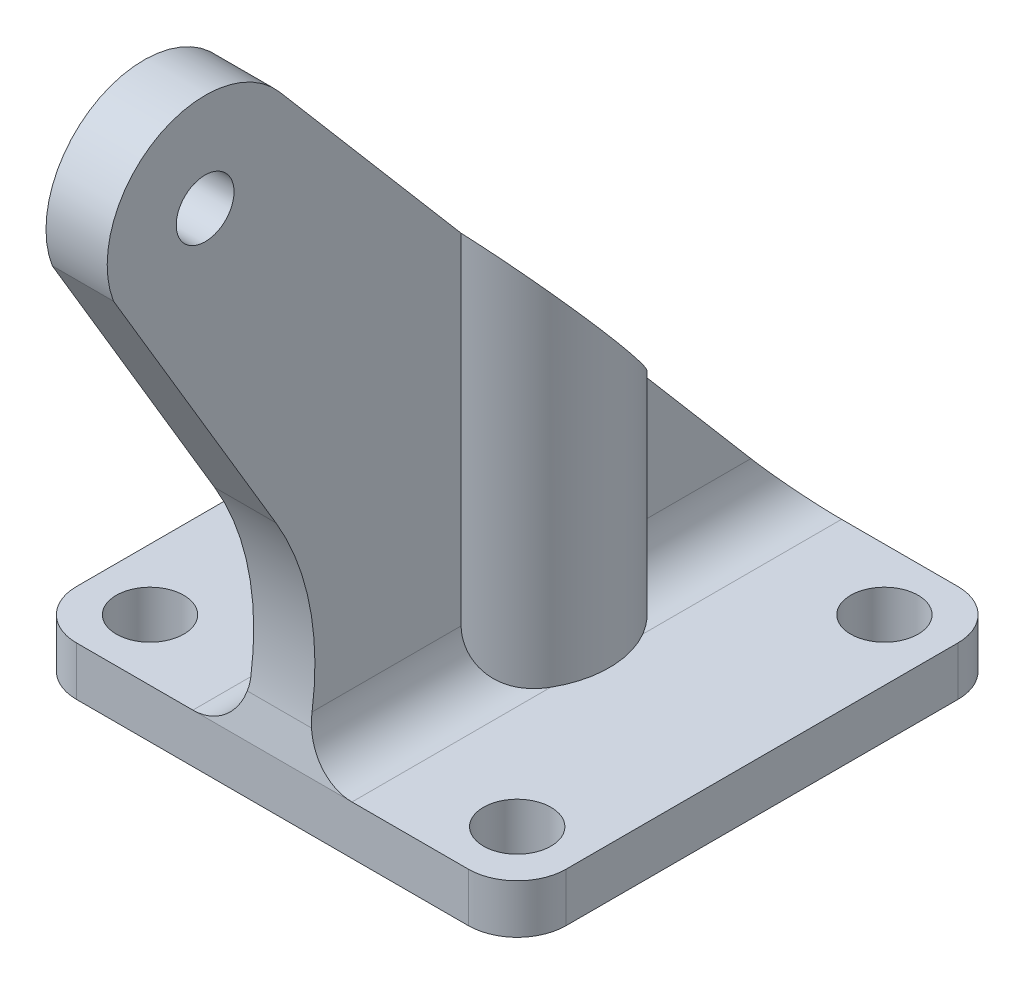
from build123d import *

# Parameters (mm, degrees)
BOSS_EXTRUDE1_DEPTH     = 2.54
SKETCH3_R               = 1.5000000000000009
BOSS_EXTRUDE2_DEPTH     = 1.5875
FILLET1_START           = -12.7000001
FILLET1_DEPTH           = 25.4000001
FILLET1_START_2         = -5
FILLET1_2_DEPTH         = 10
FILLET2_R               = 2.54
SKETCH4_R               = 3.5
BOSS_EXTRUDE3_DEPTH     = 7
SKETCH5_R               = 1.75
CUT_EXTRUDE1_DEPTH      = 45.14049388033623
CUT_EXTRUDE2_DEPTH      = 39.723935750385714
CUT_EXTRUDE2_DEPTH_BACK = 2
SKETCH6_R               = 3.5
SKETCH10_R              = 4.77
SKETCH10_R_2            = 3.5
BOSS_EXTRUDE4_DEPTH     = 21.844000000000005
SKETCH9_R               = 1.7499999999999998
CUT_EXTRUDE4_DEPTH      = 43.12113483751359
CUT_EXTRUDE5_DEPTH      = 45.62315381335121
CUT_EXTRUDE5_DEPTH_BACK = 45.62315381335121


with BuildPart() as part:
    # Sketch1 → Boss-Extrude1 (new body)
    with BuildSketch(Plane(origin=(0, 0, 0), x_dir=(1, 0, 0), z_dir=(0, 1, 0))):
        Polygon((-12.7, 12.699999999999998), (12.7, 12.699999999999998), (12.700000000000003, -12.700000000000001), (-12.699999999999996, -12.700000000000001), align=None)
    extrude(amount=BOSS_EXTRUDE1_DEPTH)

    # Sketch3 → Boss-Extrude2 (add, symmetric)
    with BuildSketch(Plane(origin=(0, 0, 0), x_dir=(0, 0, -1), z_dir=(1, 0, 0))):
        with BuildLine():
            Line((-22.53488, 28.691839999999996), (-14.109077453558108, 14.51812311143032))
            ThreePointArc((-14.109077453558108, 14.51812311143032), (-12.3014463794853, 9.646212675108597), (-12.336895325054973, 4.449888515498061))
            Line((-12.336895325054973, 4.449888515498061), (-12.700000000000001, 2.54))
            Line((-12.700000000000001, 2.54), (12.699999999999998, 2.54))
            Line((12.699999999999998, 2.54), (-13.91324894993197, 33.77463750916512))
            ThreePointArc((-13.91324894993197, 33.77463750916512), (-20.3599032710008, 34.856128324475804), (-22.53488, 28.691839999999996))
        make_face()
        with Locations((-17.779999999999998, 30.479999999999997)):
            Circle(SKETCH3_R, mode=Mode.SUBTRACT)
    extrude(amount=BOSS_EXTRUDE2_DEPTH, both=True)

    # Fillet1: read off the stored shape, not the designer's step
    # Fillet1 outline → Fillet1 (add)
    with BuildSketch(Plane.XY.offset(FILLET1_START)):
        with BuildLine():
            ThreePointArc((-1.5875, 5.08), (-2.331448776, 3.283948776), (-4.1275, 2.54))
            Line((-4.1275, 2.54), (-1.5875, 2.54))
            Line((-1.5875, 2.54), (-1.5875, 5.08))
        make_face()
        with BuildLine():
            Line((1.5875, 2.54), (4.1275, 2.54))
            ThreePointArc((4.1275, 2.54), (2.331448776, 3.283948776), (1.5875, 5.08))
            Line((1.5875, 5.08), (1.5875, 2.54))
        make_face()
    extrude(amount=FILLET1_DEPTH)

    # Fillet1 2 outline → Fillet1 2 (cut)
    with BuildSketch(Plane.YZ.offset(FILLET1_START_2)):
        Polygon((5.08, -10.535811211), (2.54, -12.7), (5.08, -12.7000001), align=None)
        with BuildLine():
            Line((5.08, 12.7), (2.54, 12.7))
            Line((2.54, 12.7), (4.449888515, 12.336895325))
            ThreePointArc((4.449888515, 12.336895325), (4.764360857, 12.280707955), (5.08, 12.231496116))
            Line((5.08, 12.231496116), (5.08, 12.7))
        make_face()
    extrude(amount=FILLET1_2_DEPTH, mode=Mode.SUBTRACT)

    # Fillet2
    fillet2_edges = [part.edges().sort_by_distance(p)[0] for p in [
        (12.7, 1.27, -12.699999999999998),
        (12.700000000000003, 1.27, 12.700000000000001),
        (-12.699999999999996, 1.27, 12.700000000000001),
        (-12.7, 1.27, -12.699999999999998),
    ]]
    fillet(fillet2_edges, radius=FILLET2_R)

    # Sketch4 → Boss-Extrude3 (add)
    with BuildSketch(Plane.XZ):
        Circle(SKETCH4_R)
    extrude(amount=-BOSS_EXTRUDE3_DEPTH)

    # Sketch5 → Cut-Extrude1 (cut, through all)
    with BuildSketch(Plane.XZ):
        with Locations(Location((0, 0, 0), (0, 0, 270))):
            Circle(SKETCH5_R)
    extrude(amount=-CUT_EXTRUDE1_DEPTH, mode=Mode.SUBTRACT)

    # Sketch6 → Cut-Extrude2 (cut, two sides: drawn at the far end of the back side and taken through both)
    with BuildSketch(Plane(origin=(0, 7, 0), x_dir=(1, 0, 0), z_dir=(0, 1, 0)).offset(-CUT_EXTRUDE2_DEPTH_BACK)):
        Circle(SKETCH6_R)
    extrude(amount=CUT_EXTRUDE2_DEPTH + CUT_EXTRUDE2_DEPTH_BACK, mode=Mode.SUBTRACT)

    # Sketch10 → Boss-Extrude4 (add)
    with BuildSketch(Plane(origin=(0, 2.54, 0), x_dir=(1, 0, 0), z_dir=(0, 1, 0))):
        with Locations(Location((0, 0, 0), (0, 0, 70.560627051))):
            Circle(SKETCH10_R)
        with Locations(Location((0, 0, 0), (0, 0, 270))):
            Circle(SKETCH10_R_2, mode=Mode.SUBTRACT)
    extrude(amount=BOSS_EXTRUDE4_DEPTH)

    # Sketch9 → Cut-Extrude4 (cut, through all)
    with BuildSketch(Plane(origin=(0, 2.54, 0), x_dir=(1, 0, 0), z_dir=(0, 1, 0))):
        with Locations(Location((-9.524999999999999, -9.525000000000002, 0), (0, 0, 270))):
            Circle(SKETCH9_R)
        with Locations(Location((-9.524999999999999, 9.524999999999999, 0), (0, 0, 270))):
            Circle(SKETCH9_R)
        with Locations(Location((9.525000000000002, 9.525000000000002, 0), (0, 0, 270))):
            Circle(SKETCH9_R)
        with Locations(Location((9.525000000000002, -9.524999999999999, 0), (0, 0, 270))):
            Circle(SKETCH9_R)
    extrude(amount=-CUT_EXTRUDE4_DEPTH, mode=Mode.SUBTRACT)

    # Sketch8 → Cut-Extrude5 (cut, two sides: drawn at the far end of the back side and taken through both)
    with BuildSketch(Plane(origin=(1.5875, 0, 0), x_dir=(0, 0, -1), z_dir=(1, 0, 0)).offset(-CUT_EXTRUDE5_DEPTH_BACK)):
        Polygon((-9.955433984779507, 29.129548290728966), (6.7091639016479245, 9.571144309395804), (6.709163901647932, 29.129548290728973), align=None)
    extrude(amount=CUT_EXTRUDE5_DEPTH + CUT_EXTRUDE5_DEPTH_BACK, mode=Mode.SUBTRACT)


solid = part.part
